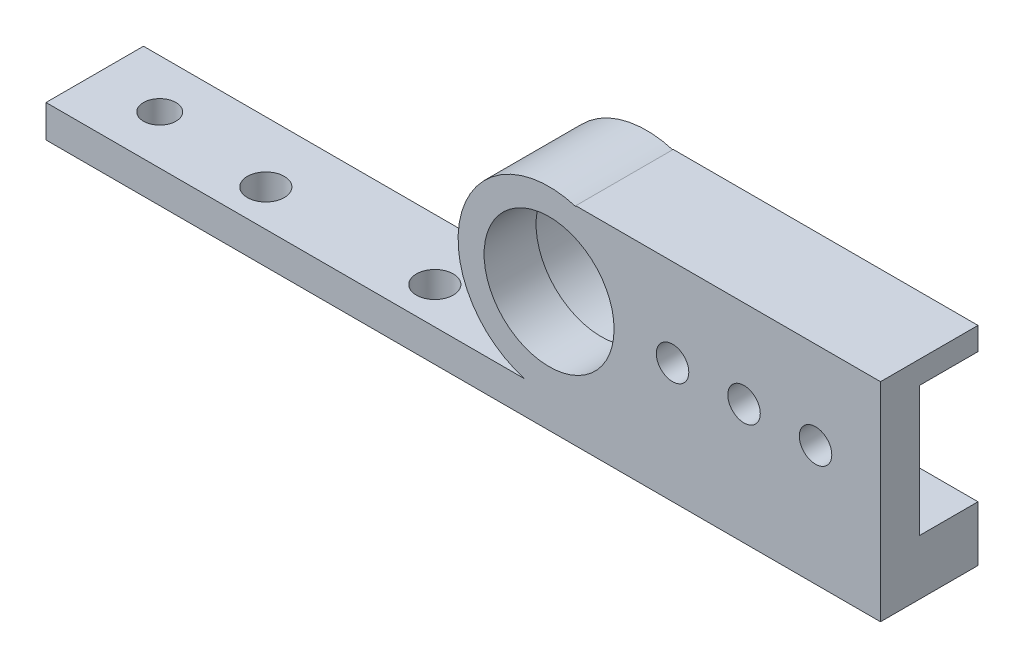
from build123d import *

# Parameters (mm, degrees)
SKETCH_1_W          = 40
SKETCH_1_H          = 20
EXTRUDE_1_DEPTH     = 6
SKETCH_2_R          = 2.5
CUT_EXTRUDE_1_DEPTH = 24.151673806
EXTRUDE_START       = -15
EXTRUDE_2_OUTLINE_R = 11
EXTRUDE_2_DEPTH     = 15
EXTRUDE_START_2     = -8
SKETCH_5_R          = 11
SKETCH_5_R_2        = 10
EXTRUDE_3_DEPTH     = 8
SKETCH_10_W         = 15
SKETCH_10_H         = 5
EXTRUDE_4_DEPTH     = 200
SKETCH_11_W         = 3.09493726
SKETCH_11_H         = 3.09493726
EXTRUDE_5_DEPTH     = 15
SKETCH_17_W         = 83.501719846
SKETCH_17_H         = 42.356909186
CUT_EXTRUDE_2_DEPTH = 184.131783151
SKETCH_18_R         = 2.5
CUT_EXTRUDE_3_DEPTH = 10
SKETCH_20_R         = 2.837069856
CUT_EXTRUDE_4_DEPTH = 10


# Read off the part's stored shape, not the designer's step: 凸台-拉伸2
with BuildPart() as part:
    # 草图1 → 凸台-拉伸1 (new body)
    with BuildSketch(Plane.XY):
        Rectangle(SKETCH_1_W, SKETCH_1_H)
    extrude(amount=EXTRUDE_1_DEPTH)

    # 草图2 → 切除-拉伸1 (cut, through all)
    with BuildSketch(Plane.XY.offset(6)):
        with Locations((10, 0)):
            Circle(SKETCH_2_R)
        with Locations((-1, 0)):
            Circle(SKETCH_2_R)
        with Locations((-12, 0)):
            Circle(SKETCH_2_R)
    extrude(amount=-CUT_EXTRUDE_1_DEPTH, mode=Mode.SUBTRACT)

    # 凸台-拉伸2 outline → 凸台-拉伸2 (add)
    with BuildSketch(Plane.XY.offset(6).offset(EXTRUDE_START)):
        with BuildLine():
            Line((20, 10), (20, 13.5))
            Line((20, 13.5), (-26.893967141, 13.5))
            Line((-26.893967141, 13.5), (-26.893967141, 13.384337644))
            ThreePointArc((-26.893967141, 13.384337644), (-45, 0), (-26.893967141, -13.384337644))
            Line((-26.893967141, -13.384337644), (-26.893967141, -13.5))
            Line((-26.893967141, -13.5), (20, -13.5))
            Line((20, -13.5), (20, -10))
            Line((20, -10), (-20, -10))
            Line((-20, -10), (-20, -8.660254038))
            ThreePointArc((-20, -8.660254038), (-17, 0), (-20, 8.660254038))
            Line((-20, 8.660254038), (-20, 10))
            Line((-20, 10), (20, 10))
        make_face()
        with Locations((-31, 0)):
            Circle(EXTRUDE_2_OUTLINE_R, mode=Mode.SUBTRACT)
    extrude(amount=EXTRUDE_2_DEPTH)

    # 草图5 → 凸台-拉伸3 (add)
    with BuildSketch(Plane.XY.offset(6).offset(EXTRUDE_START_2)):
        with Locations((-31, 0)):
            Circle(SKETCH_5_R)
        with Locations((-31, 0)):
            Circle(SKETCH_5_R_2, mode=Mode.SUBTRACT)
    extrude(amount=EXTRUDE_3_DEPTH)

    # 草图10 → 凸台-拉伸4 (add)
    with BuildSketch(Plane(origin=(20, 0, 0), x_dir=(0, 0, -1), z_dir=(1, 0, 0))):
        with Locations((1.5, -16)):
            Rectangle(SKETCH_10_W, SKETCH_10_H)
    extrude(amount=-EXTRUDE_4_DEPTH)

    # 草图11 → 凸台-拉伸5 (add, through all)
    with BuildSketch(Plane.XY.offset(6)):
        with Locations((-27.071814196, -13.413570993)):
            Rectangle(SKETCH_11_W, SKETCH_11_H)
    extrude(amount=-EXTRUDE_5_DEPTH)

    # 草图17 → 切除-拉伸2 (cut, through all)
    with BuildSketch(Plane.XZ.offset(18.5)):
        with Locations((-150.158557574, 4.061352957)):
            Rectangle(SKETCH_17_W, SKETCH_17_H)
    extrude(amount=-CUT_EXTRUDE_2_DEPTH, mode=Mode.SUBTRACT)

    # 草图18 → 切除-拉伸3 (cut)
    with BuildSketch(Plane.XZ.offset(18.5)):
        with Locations(Location((-98.407697651, -1.5, 0), (0, 0, 270))):
            Circle(SKETCH_18_R)
    extrude(amount=-CUT_EXTRUDE_3_DEPTH, mode=Mode.SUBTRACT)

    # 草图20 → 切除-拉伸4 (cut)
    with BuildSketch(Plane.XZ.offset(18.5)):
        with Locations(Location((-54.23606844, 0.343836832, 0), (0, 0, 270))):
            Circle(SKETCH_20_R)
        with Locations(Location((-80.23606844, 0.343836832, 0), (0, 0, 270))):
            Circle(SKETCH_20_R)
    extrude(amount=-CUT_EXTRUDE_4_DEPTH, mode=Mode.SUBTRACT)


solid = part.part
